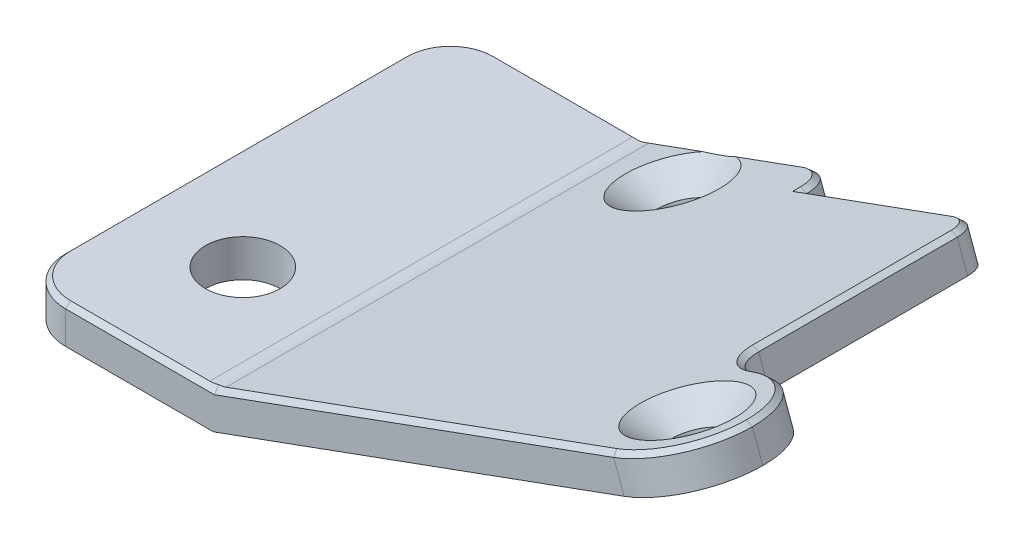
from build123d import *
from OCP.BRepFilletAPI import BRepFilletAPI_MakeFillet

# Parameters (mm, degrees)
SKETCH1_W                                       = 12.3
SKETCH1_H                                       = 27.2
BOSS_EXTRUDE1_DEPTH                             = 2.35
BOSS_EXTRUDE2_DEPTH                             = 27.2
SKETCH3_W                                       = 11.9
SKETCH3_H                                       = 2.2
CUT_EXTRUDE1_DEPTH                              = 35.76078799
FILLET1_R1                                      = 2
FILLET1_R2                                      = 1.5
FILLET1_R3                                      = 3
SKETCH4_R                                       = 2.35
CUT_EXTRUDE2_DEPTH                              = 35.103483837
SKETCH6_W                                       = 6.5
SKETCH6_H                                       = 9
BOSS_EXTRUDE4_DEPTH                             = 2.208277659
FILLET3_R                                       = 2
FILLET4_R                                       = 4.5
CSK_FOR_M3_FLAT_HEAD_MACHINE_SCREW1_D           = 3.2
CSK_FOR_M3_FLAT_HEAD_MACHINE_SCREW1_CSINK_D     = 6.3
CSK_FOR_M3_FLAT_HEAD_MACHINE_SCREW1_CSINK_ANGLE = 90
FILLET6_R                                       = 3
CHAMFER2_SIZE                                   = 0.3
FILLET7_R                                       = 3
SKETCH14_W                                      = 6
SKETCH14_H                                      = 11
BOSS_EXTRUDE5_DEPTH                             = 0.3
SKETCH15_W                                      = 6
SKETCH15_H                                      = 9
CUT_EXTRUDE3_DEPTH                              = 0.5
FILLET8_R                                       = 4


# Some blends are built 0.0001 mm under size
with BuildPart() as part:
    # Sketch1 → Boss-Extrude1 (new body)
    with BuildSketch(Plane(origin=(0, 0, 0), x_dir=(1, 0, 0), z_dir=(0, 1, 0))):
        Rectangle(SKETCH1_W, SKETCH1_H)
    extrude(amount=BOSS_EXTRUDE1_DEPTH)

    # Sketch2 → Boss-Extrude2 (add)
    with BuildSketch(Plane.XY.offset(13.6)):
        Polygon((6.15, 2.35), (29.356886389, 10.796615875), (30.11216183, 8.721513655), (6.15, 0), align=None)
    extrude(amount=-BOSS_EXTRUDE2_DEPTH)

    # Sketch3 → Cut-Extrude1 (cut, through all)
    with BuildSketch(Plane(origin=(-0.035862104, 0.098530321, 0), x_dir=(0.9396926207859082, 0.34202014332566943, 0), z_dir=(-0.34202014332566943, 0.9396926207859082, 0))):
        with Locations((25.329109618, 12.5)):
            Rectangle(SKETCH3_W, SKETCH3_H)
    extrude(amount=-CUT_EXTRUDE1_DEPTH, mode=Mode.SUBTRACT)

    # Fillet1: one fillet with a radius per group of edges: ONE call of the kernel's fillet builder (fillet() takes one radius for all edges)
    fillet1_edges_1 = [part.edges().sort_by_distance(p)[0] for p in [
        (18.552181922, 5.68902506, -13.6),
    ]]
    fillet1_edges_2 = [part.edges().sort_by_distance(p)[0] for p in [
        (29.734524109, 9.759064765, -11.4),
    ]]
    fillet1_edges_3 = [part.edges().sort_by_distance(p)[0] for p in [
        (-6.15, 1.175, -13.6),
    ]]
    fillet1 = BRepFilletAPI_MakeFillet(part.part.solid().wrapped)
    for e in fillet1_edges_1:
        fillet1.Add(FILLET1_R1, e.wrapped)
    for e in fillet1_edges_2:
        fillet1.Add(FILLET1_R2, e.wrapped)
    for e in fillet1_edges_3:
        fillet1.Add(FILLET1_R3, e.wrapped)
    add(Compound.cast(fillet1.Shape()), mode=Mode.REPLACE)

    # Sketch4 → Cut-Extrude2 (cut, through all)
    with BuildSketch(Plane(origin=(0, 2.35, 0), x_dir=(1, 0, 0), z_dir=(0, 1, 0))):
        with Locations(Location((0.45, -6.05, 0), (0, 0, 270))):
            Circle(SKETCH4_R)
    extrude(amount=-CUT_EXTRUDE2_DEPTH, mode=Mode.SUBTRACT)

    # Sketch6 → Boss-Extrude4 (add)
    with BuildSketch(Plane(origin=(-0.035862104, 0.098530321, 0), x_dir=(0.9396926207859082, 0.34202014332566943, 0), z_dir=(-0.34202014332566943, 0.9396926207859082, 0))):
        with Locations((34.529109618, -9.1)):
            Rectangle(SKETCH6_W, SKETCH6_H)
    extrude(amount=-BOSS_EXTRUDE4_DEPTH)

    # Fillet3
    fillet3_edges = [part.edges().sort_by_distance(p)[0] for p in [
        (29.734524109, 9.759064765, 4.6),
    ]]
    fillet(fillet3_edges, radius=FILLET3_R)

    # Fillet4
    fillet4_edges = [part.edges().sort_by_distance(p)[0] for p in [
        (35.842526144, 11.982195697, 13.6),
        (35.842526144, 11.982195697, 4.6),
    ]]
    fillet(fillet4_edges, radius=FILLET4_R - 0.0001)  # a hair under: the kernel refuses the full size

    # CSK for M3 Flat Head Machine Screw1 (through all)
    with Locations(Plane(origin=(-0.035862104, 0.098530321, 0), x_dir=(0.9396926207859082, 0.34202014332566943, 0), z_dir=(-0.34202014332566943, 0.9396926207859082, 0))):
        with Locations((33.529109618, -9.1), (11.829109618, 10.35)):
            CounterSinkHole(CSK_FOR_M3_FLAT_HEAD_MACHINE_SCREW1_D / 2, CSK_FOR_M3_FLAT_HEAD_MACHINE_SCREW1_CSINK_D / 2, counter_sink_angle=CSK_FOR_M3_FLAT_HEAD_MACHINE_SCREW1_CSINK_ANGLE)

    # Fillet6
    fillet6_edges = [part.edges().sort_by_distance(p)[0] for p in [
        (-6.15, 1.175, 13.6),
    ]]
    fillet(fillet6_edges, radius=FILLET6_R)

    # Chamfer2
    # the kernel refuses this chamfer: 0.3 mm, written as the material it takes off along each edge
    with BuildSketch(Plane(origin=(-3.15, 2.35, 13.6), x_dir=(0, -1, 0), z_dir=(1, 0, 0))) as chamfer2_piece_1_section:
        Polygon((CHAMFER2_SIZE, 0), (0, CHAMFER2_SIZE), (0, 0), align=None)
    chamfer2_piece_1 = extrude(amount=10.071504896, mode=Mode.PRIVATE)
    chamfer2_piece_1 = split(chamfer2_piece_1, bisect_by=Plane(origin=(-2.554750309, 0.714564914, 11.859606334), z_dir=(-0.2418447626479751, 0.6644630243886727, 0.7071067811865496)), keep=Keep.TOP, mode=Mode.PRIVATE)
    add(chamfer2_piece_1, mode=Mode.SUBTRACT)
    with BuildSketch(Plane(origin=(-3.15, 2.35, 10.6), x_dir=(-1, 0, 0), z_dir=(0, 0, -1))) as chamfer2_piece_2:
        Polygon((3, -CHAMFER2_SIZE), (3 - CHAMFER2_SIZE, 0), (3, 0), align=None)
    revolve(axis=Axis((-3.15, 2.35, 10.6), (0, 1, 0)), revolution_arc=90, mode=Mode.SUBTRACT)
    with BuildSketch(Plane(origin=(5.425022542, 2.086129785, -13.6), x_dir=(0.34202014332566943, -0.9396926207859082, 0), z_dir=(0.9396926207859081, 0.34202014332566943, 0))) as chamfer2_piece_3_section:
        Polygon((CHAMFER2_SIZE, 0), (0, -CHAMFER2_SIZE), (0, 0), align=None)
    chamfer2_piece_3 = extrude(amount=11.56775756, mode=Mode.PRIVATE)
    chamfer2_piece_3 = split(chamfer2_piece_3, bisect_by=Plane(origin=(5.425022542, 2.068064892, -13.581935108), z_dir=(0, 0.7071067811865486, -0.7071067811865465)), keep=Keep.TOP, mode=Mode.PRIVATE)
    add(chamfer2_piece_3, mode=Mode.SUBTRACT)
    with BuildSketch(Plane(origin=(17.449566743, 6.462705955, -11.4), x_dir=(0, 0, 1), z_dir=(0.9396926207859082, 0.34202014332566943, 0))) as chamfer2_piece_4_section:
        Polygon((CHAMFER2_SIZE, 0), (0, CHAMFER2_SIZE), (0, 0), align=None)
    chamfer2_piece_4 = extrude(amount=11.171504896, mode=Mode.PRIVATE)
    chamfer2_piece_4 = split(chamfer2_piece_4, bisect_by=Plane(origin=(17.590469493, 6.764872877, -11.4), z_dir=(0.42261826174069733, 0.9063077870366509, 0)), keep=Keep.TOP, mode=Mode.PRIVATE)
    add(chamfer2_piece_4, mode=Mode.SUBTRACT)
    with BuildSketch(Plane(origin=(-6.15, 2.35, -10.6), x_dir=(0, -1, 0), z_dir=(0, 0, 1))) as chamfer2_piece_5:
        Polygon((CHAMFER2_SIZE, 0), (0, CHAMFER2_SIZE), (0, 0), align=None)
    extrude(amount=21.2, mode=Mode.SUBTRACT)
    with BuildSketch(Plane(origin=(-3.15, 2.35, -10.6), x_dir=(-1, 0, 0), z_dir=(0, 0, 1))) as chamfer2_piece_6:
        Polygon((3, CHAMFER2_SIZE), (3 - CHAMFER2_SIZE, 0), (3, 0), align=None)
    revolve(axis=Axis((-3.15, 2.35, -10.6), (0, -1, 0)), revolution_arc=90, mode=Mode.SUBTRACT)
    with BuildSketch(Plane(origin=(29.356886389, 10.796615875, 2.6), x_dir=(-0.9396926207859078, -0.34202014332567043, 0), z_dir=(0, 0, -1))) as chamfer2_piece_7:
        Polygon((CHAMFER2_SIZE, 0), (0, -CHAMFER2_SIZE), (0, 0), align=None)
    extrude(amount=12.5, mode=Mode.SUBTRACT)
    with BuildSketch(Plane(origin=(18.174544201, 6.72657617, -11.6), x_dir=(-0.9396926207859083, -0.342020143325669, 0), z_dir=(0, 0, 1))) as chamfer2_piece_8_section:
        Polygon((CHAMFER2_SIZE, 0), (0, CHAMFER2_SIZE), (0, 0), align=None)
    chamfer2_piece_8 = extrude(amount=0.971504896, mode=Mode.PRIVATE)
    chamfer2_piece_8 = split(chamfer2_piece_8, bisect_by=Plane(origin=(18.260049237, 6.491653015, -11.35), z_dir=(-0.24184476264797733, 0.6644630243886783, -0.7071067811865436)), keep=Keep.TOP, mode=Mode.PRIVATE)
    add(chamfer2_piece_8, mode=Mode.SUBTRACT)
    with BuildSketch(Plane(origin=(16.29515896, 6.042535883, -11.6), x_dir=(0, 0, -1), z_dir=(-0.9396926207859082, -0.34202014332566943, 0))) as chamfer2_piece_9:
        Polygon((2 - CHAMFER2_SIZE, 0), (2, CHAMFER2_SIZE), (2, 0), align=None)
    revolve(axis=Axis((16.29515896, 6.042535883, -11.6), (0.34202014332566943, -0.9396926207859082, 0)), revolution_arc=90, mode=Mode.SUBTRACT)
    with BuildSketch(Plane(origin=(27.947347457, 10.28358566, -9.9), x_dir=(0.9396926207859081, 0.3420201433256695, 0), z_dir=(0, 0, 1))) as chamfer2_piece_10:
        Polygon((1.5 - CHAMFER2_SIZE, 0), (1.5, -CHAMFER2_SIZE), (1.5, 0), align=None)
    revolve(axis=Axis((27.947347457, 10.28358566, -9.9), (-0.34202014332566943, 0.9396926207859082, 0)), revolution_arc=90, mode=Mode.SUBTRACT)
    with BuildSketch(Plane(origin=(6.921504896, 2.35, -13.6), x_dir=(0, -1, 0), z_dir=(-1, 0, 0))) as chamfer2_piece_11_section:
        Polygon((CHAMFER2_SIZE, 0), (0, CHAMFER2_SIZE), (0, 0), align=None)
    chamfer2_piece_11 = extrude(amount=10.071504896, mode=Mode.PRIVATE)
    chamfer2_piece_11 = split(chamfer2_piece_11, bisect_by=Plane(origin=(6.927683453, 2.333024554, -13.581935108), z_dir=(-0.24184476264797608, 0.6644630243886753, -0.7071067811865468)), keep=Keep.TOP, mode=Mode.PRIVATE)
    add(chamfer2_piece_11, mode=Mode.SUBTRACT)
    with BuildSketch(Plane(origin=(31.23627163, 11.480656162, 2.6), x_dir=(0, 0, 1), z_dir=(0.9396926207859082, 0.3420201433256694, 0))) as chamfer2_piece_12:
        Polygon((2 + CHAMFER2_SIZE, 0), (2, CHAMFER2_SIZE), (2, 0), align=None)
    revolve(axis=Axis((31.23627163, 11.480656162, 2.6), (0.3420201433256694, -0.9396926207859082, 0)), revolution_arc=90, mode=Mode.SUBTRACT)
    with BuildSketch(Plane(origin=(31.236365599, 11.480690364, 13.6), x_dir=(0.34202014332566943, -0.9396926207859082, 0), z_dir=(-0.9396926207859082, -0.34202014332566943, 0))) as chamfer2_piece_13_section:
        Polygon((CHAMFER2_SIZE, 0), (0, -CHAMFER2_SIZE), (0, 0), align=None)
    chamfer2_piece_13 = extrude(amount=27.46785756, mode=Mode.PRIVATE)
    chamfer2_piece_13 = split(chamfer2_piece_13, bisect_by=Plane(origin=(31.236365599, 6.765345182, 8.884654818), z_dir=(0, 0.7071067811865486, 0.7071067811865465)), keep=Keep.TOP, mode=Mode.PRIVATE)
    add(chamfer2_piece_13, mode=Mode.SUBTRACT)
    with BuildSketch(Plane(origin=(31.236365599, 11.480690364, 9.0999), x_dir=(0, 0, -1), z_dir=(-0.9396926207859082, -0.3420201433256694, 0))) as chamfer2_piece_14:
        Polygon((4.4999 - CHAMFER2_SIZE, 0), (4.4999, CHAMFER2_SIZE), (4.4999, 0), align=None)
    revolve(axis=Axis((31.236365599, 11.480690364, 9.0999), (0.3420201433256694, -0.9396926207859082, 0)), revolution_arc=90, mode=Mode.SUBTRACT)
    with BuildSketch(Plane(origin=(31.236365599, 11.480690364, 9.1001), x_dir=(0.9396926207859081, 0.3420201433256696, 0), z_dir=(0, 0, -1))) as chamfer2_piece_15:
        Polygon((4.4999 - CHAMFER2_SIZE, 0), (4.4999, CHAMFER2_SIZE), (4.4999, 0), align=None)
    revolve(axis=Axis((31.236365599, 11.480690364, 9.1001), (0.3420201433256694, -0.9396926207859082, 0)), revolution_arc=90, mode=Mode.SUBTRACT)
    with BuildSketch(Plane(origin=(35.464888424, 13.019746807, 9.1001), x_dir=(-0.9396926207859088, -0.34202014332566755, 0), z_dir=(0, 0, -1))) as chamfer2_piece_16:
        Polygon((CHAMFER2_SIZE, 0), (0, -CHAMFER2_SIZE), (0, 0), align=None)
    extrude(amount=0.0002, mode=Mode.SUBTRACT)
    with BuildSketch(Plane(origin=(31.236365599, 11.480690364, 4.6), x_dir=(0, 0, 1), z_dir=(-0.9396926207859082, -0.34202014332566943, 0))) as chamfer2_piece_17:
        Polygon((CHAMFER2_SIZE, 0), (0, -CHAMFER2_SIZE), (0, 0), align=None)
    extrude(amount=0.0001, mode=Mode.SUBTRACT)

    # Fillet7
    fillet7_edges = [part.edges().sort_by_distance(p)[0] for p in [
        (6.15, 2.35, 0),
    ]]
    fillet(fillet7_edges, radius=FILLET7_R)

    # Sketch14 → Boss-Extrude5 (add)
    with BuildSketch(Plane(origin=(0.719413337, -1.9765719, 0), x_dir=(0.9396926207859082, 0.34202014332566943, 0), z_dir=(0.34202014332566943, -0.9396926207859082, 0))):
        with Locations((11.829109618, 1.65)):
            Rectangle(SKETCH14_W, SKETCH14_H)
    extrude(amount=BOSS_EXTRUDE5_DEPTH)

    # Sketch15 → Cut-Extrude3 (cut)
    with BuildSketch(Plane(origin=(0.719413337, -1.9765719, 0), x_dir=(0.9396926207859082, 0.34202014332566943, 0), z_dir=(0.34202014332566943, -0.9396926207859082, 0))):
        with Locations((23.779109618, -1.65)):
            Rectangle(SKETCH15_W, SKETCH15_H)
    extrude(amount=-CUT_EXTRUDE3_DEPTH, mode=Mode.SUBTRACT)

    # Fillet8
    # the kernel refuses this fillet: 4 mm, written as the material it adds along each edge
    with BuildSketch(Plane(origin=(25.712534965, 7.65226932, 7.691229183), x_dir=(0.3420201433256748, -0.9396926207859063, 0), z_dir=(0, 0, -1)), Plane(origin=(20.07437924, 5.60014846, -10.991229183), x_dir=(0.3420201433256691, -0.9396926207859082, 0), z_dir=(0, 0, 1))) as fillet8_piece_1:
        with BuildLine():
            CenterArc((4, 1.936491673), FILLET8_R, 180, 28.955024372)
            Line((0, 1.936491673), (-0.08, 1.936491673))
            Line((-0.08, 1.936491673), (-0.08, 0))
            Line((-0.08, 0), (0, -0.08))
            ThreePointArc((0, -0.08), (0.25, -0.08), (0.43, -0.038729833))
            Line((0.43, -0.038729833), (0.5, 0))
        make_face()
    extrude(amount=18.682458366)


solid = part.part
